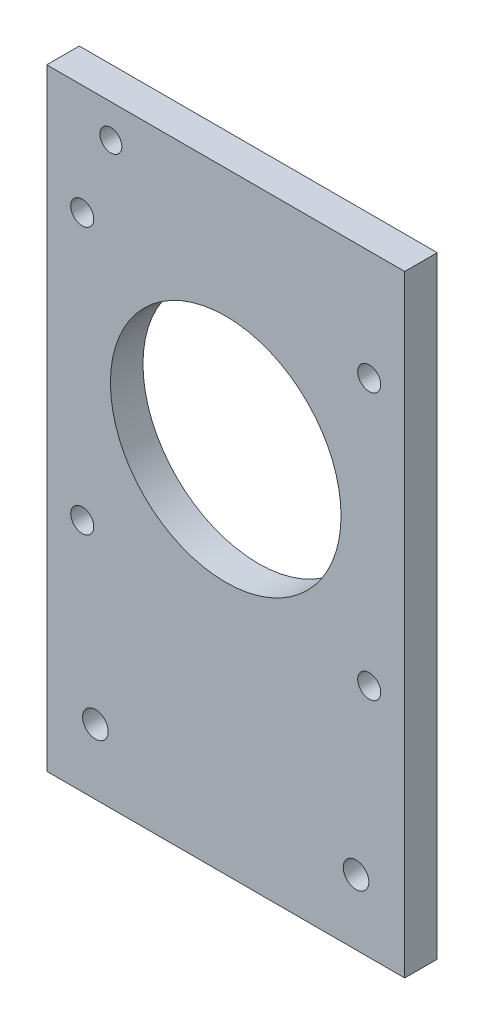
from build123d import *

# Parameters (mm, degrees)
SKETCH2_R               = 22.5
BOSS_EXTRUDE1_DEPTH     = 3.175
CUT_EXTRUDE1_DEPTH      = 125.564995585
CUT_EXTRUDE1_DEPTH_BACK = 125.564995585
SKETCH3_R               = 2.5
SKETCH3_R_2             = 2.15
CUT_EXTRUDE2_DEPTH      = 125.564995585
CUT_EXTRUDE2_DEPTH_BACK = 125.564995585
SKETCH4_R               = 2.25


with BuildPart() as part:
    # Sketch2 → Boss-Extrude1 (new, symmetric)
    with BuildSketch(Plane.XY):
        Polygon((-34.925, 0), (34.925, 0), (34.925, 71.9), (34.925, 104.4), (34.925, 119.4), (-34.925, 119.4), (-34.925, 104.4), (-34.925, 71.9), align=None)
        with Locations((0, 71.9)):
            Circle(SKETCH2_R, mode=Mode.SUBTRACT)
    extrude(amount=BOSS_EXTRUDE1_DEPTH, both=True)

    # Sketch3 → Cut-Extrude1 (cut, two sides: drawn at the far end of the back side and taken through both)
    with BuildSketch(Plane.XY.offset(3.175).offset(-CUT_EXTRUDE1_DEPTH_BACK)):
        with Locations((-25.425, 12.7)):
            Circle(SKETCH3_R)
        with Locations((25.425, 12.7)):
            Circle(SKETCH3_R)
        with Locations((-22.425, 112.9)):
            Circle(SKETCH3_R_2)
    extrude(amount=CUT_EXTRUDE1_DEPTH + CUT_EXTRUDE1_DEPTH_BACK, mode=Mode.SUBTRACT)

    # Sketch4 → Cut-Extrude2 (cut, two sides: drawn at the far end of the back side and taken through both)
    with BuildSketch(Plane(origin=(0, 0, -3.175), x_dir=(-1, 0, 0), z_dir=(0, 0, -1)).offset(-CUT_EXTRUDE2_DEPTH_BACK)):
        with Locations((28, 45.9)):
            Circle(SKETCH4_R)
        with Locations((-28, 45.9)):
            Circle(SKETCH4_R)
        with Locations((28, 97.9)):
            Circle(SKETCH4_R)
        with Locations((-28, 97.9)):
            Circle(SKETCH4_R)
    extrude(amount=CUT_EXTRUDE2_DEPTH + CUT_EXTRUDE2_DEPTH_BACK, mode=Mode.SUBTRACT)


solid = part.part
